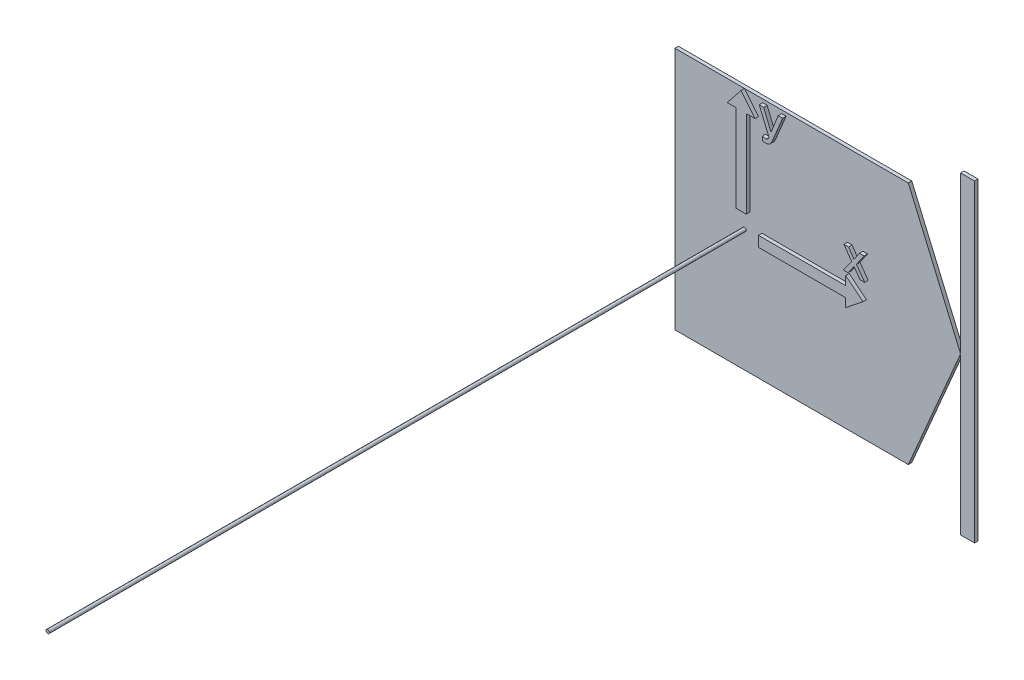
from build123d import *

# Parameters (mm, degrees)
EXTRUDE_1_DEPTH          = 1
SKETCH_2_R               = 0.5
EXTRUDE_2_DEPTH          = 200
EXTRUDE_3_DEPTH          = 1
PATTERN_CIRCULAR_1_COUNT = 2
PATTERN_CIRCULAR_1_ANGLE = 90
SKETCH_4_W               = 4
SKETCH_4_H               = 90
EXTRUDE_4_DEPTH          = 1
EXTRUDE_START            = 1
EXTRUDE_5_DEPTH          = 1


# Read off the part's stored shape, not the designer's step: 押し出し5
with BuildPart() as part:
    # ｽｹｯﾁ1 → 押し出し1 (new body)
    with BuildSketch(Plane.XY):
        Polygon((-20, -35), (-20, 35), (47, 35), (62, 0), (47, -35), align=None)
    extrude(amount=EXTRUDE_1_DEPTH)

    # ｽｹｯﾁ2 → 押し出し2 (add)
    with BuildSketch(Plane.XY.offset(1)):
        Circle(SKETCH_2_R)
    extrude(amount=EXTRUDE_2_DEPTH)

    # ｽｹｯﾁ3 → 押し出し3 (add)
    with BuildSketch(Plane.XY.offset(1)):
        Polygon((5, 1.5), (30, 1.5), (30, 4), (35, 0), (30, -4), (30, -1.5), (5, -1.5), align=None)
    extrude_3 = extrude(amount=EXTRUDE_3_DEPTH)

    # 円形ﾊﾟﾀｰﾝ1: 押し出し3 ×2 about axis
    pattern_circular_1_axis = Axis((0, 0, 0), (0, 0, 1))
    for i in range(1, PATTERN_CIRCULAR_1_COUNT):
        add(extrude_3.rotate(pattern_circular_1_axis, i * PATTERN_CIRCULAR_1_ANGLE / (PATTERN_CIRCULAR_1_COUNT - 1)))

    # 押し出し5 outline → 押し出し5 (add)
    with BuildSketch(Plane.XY.offset(EXTRUDE_START)):
        with BuildLine():
            add(Edge.make_bspline(
                [(7.646287037, 26.760441027), (7.684095406, 26.801569572), (7.761577676, 26.885856016), (7.855531929, 27.037278743), (7.934893033, 27.208972806), (7.973738313, 27.333346265), (7.993777384, 27.397506664)],
                knots=[0, 0, 0, 0, 0.22810973, 0.467474788, 0.725286809, 1, 1, 1, 1], degree=3))
            add(Edge.make_bspline(
                [(7.125051515, 26.528780796), (7.172584701, 26.531731962), (7.266774333, 26.537579862), (7.403597881, 26.583175986), (7.532315033, 26.657479619), (7.60740756, 26.725317615), (7.646287037, 26.760441027)],
                knots=[0, 0, 0, 0, 0.243362731, 0.482236686, 0.731925831, 1, 1, 1, 1], degree=3))
            add(Edge.make_bspline(
                [(6.140495531, 26.760441027), (6.218421027, 26.724977416), (6.373219293, 26.654529285), (6.617526792, 26.582085472), (6.868880788, 26.53765901), (7.039066964, 26.531760798), (7.125051515, 26.528780796)],
                knots=[0, 0, 0, 0, 0.251546113, 0.499693995, 0.747226312, 1, 1, 1, 1], degree=3))
            Line((6.140495531, 26.760441027), (6.140495531, 25.660054927))
            add(Edge.make_bspline(
                [(7.182966573, 25.428394695), (7.118594105, 25.429270849), (6.995476736, 25.430946562), (6.819487787, 25.442051989), (6.661523317, 25.457230921), (6.522149821, 25.484324643), (6.399828508, 25.514176487), (6.296115706, 25.555959151), (6.208298793, 25.60105168), (6.162045708, 25.641301694), (6.140495531, 25.660054927)],
                knots=[0, 0, 0, 0, 0.1772926, 0.339085928, 0.485673036, 0.613913128, 0.729992701, 0.831661923, 0.921568145, 1, 1, 1, 1], degree=3))
            add(Edge.make_bspline(
                [(8.341267732, 25.891715158), (8.302121003, 25.854169248), (8.225241681, 25.780433735), (8.095389821, 25.689271494), (7.963691437, 25.605006111), (7.820239111, 25.542623748), (7.671969703, 25.48846247), (7.514142965, 25.457310676), (7.351171612, 25.430508848), (7.239575543, 25.429106208), (7.182966573, 25.428394695)],
                knots=[0, 0, 0, 0, 0.126744603, 0.248910688, 0.370594491, 0.491909555, 0.614155835, 0.739210138, 0.867709987, 1, 1, 1, 1], degree=3))
            add(Edge.make_bspline(
                [(9.036248427, 27.107931375), (8.980283218, 26.973306878), (8.875802115, 26.721977235), (8.701494643, 26.384557747), (8.532933914, 26.106460729), (8.401177698, 25.958839153), (8.341267732, 25.891715158)],
                knots=[0, 0, 0, 0, 0.310327167, 0.579347877, 0.808728157, 1, 1, 1, 1], degree=3))
            Line((9.036248427, 27.107931375), (11.932001322, 34.057738324))
            Line((11.932001322, 34.057738324), (10.657870048, 34.057738324))
            Line((10.657870048, 34.057738324), (8.572927963, 28.90329817))
            Line((8.572927963, 28.90329817), (6.487985878, 34.057738324))
            Line((6.487985878, 34.057738324), (5.213854604, 34.057738324))
            Line((5.213854604, 34.057738324), (7.993777384, 27.397506664))
        make_face()
        Polygon((30.855734024, 11.52851209), (29.523687692, 11.52851209), (31.724459892, 8.343183904), (29.349942518, 5.042025603), (30.68198885, 5.042025603), (32.419440587, 7.474458036), (34.156892325, 5.042025603), (35.488938657, 5.042025603), (33.114421282, 8.343183904), (35.315193483, 11.52851209), (33.983147151, 11.52851209), (32.419440587, 9.211909773), align=None)
    extrude(amount=EXTRUDE_5_DEPTH)


with BuildPart() as body_2:
    # ｽｹｯﾁ4 → 押し出し4 (new body)
    with BuildSketch(Plane.XY.offset(1)):
        with Locations((64, 0)):
            Rectangle(SKETCH_4_W, SKETCH_4_H)
    extrude(amount=-EXTRUDE_4_DEPTH)


solid = Compound([part.part, body_2.part])
